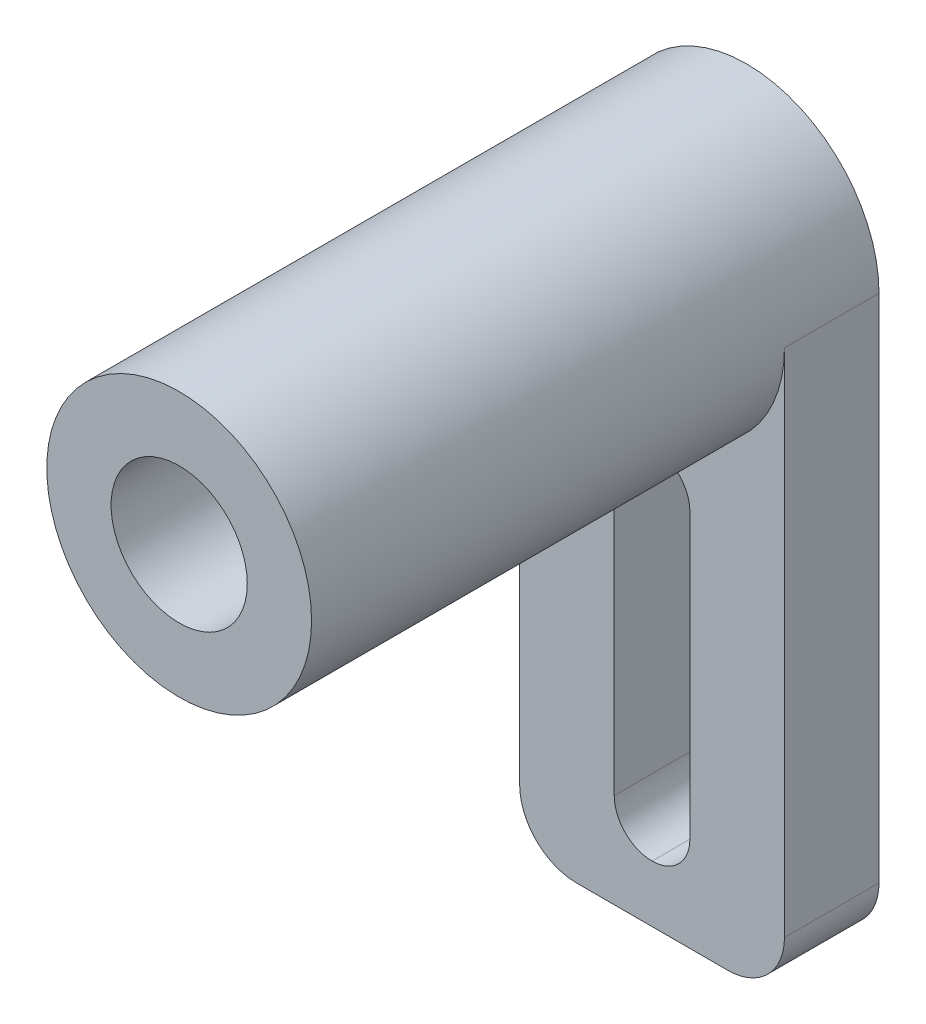
from build123d import *

# Parameters (mm, degrees)
SZKIC1_W                    = 14
SZKIC1_H                    = 25
DODANIE_WYCI_GNI_CIE1_DEPTH = 5
SZKIC2_W                    = 4
SZKIC2_H                    = 19
WYTNIJ_WYCI_GNI_CIE1_DEPTH  = 5
ZAOKR_GLENIE1_R             = 2
ZAOKR_GLENIE2_R             = 3
SZKIC3_R                    = 7
SZKIC3_R_2                  = 3.05
DODANIE_WYCI_GNI_CIE2_DEPTH = 30
DODANIE_WYCI_GNI_CIE3_DEPTH = 5
SZKIC5_R                    = 5
SZKIC5_R_2                  = 2.2
DODANIE_WYCI_GNI_CIE4_DEPTH = 1
SZKIC6_R                    = 3.6
WYTNIJ_WYCI_GNI_CIE2_DEPTH  = 22


with BuildPart() as part:
    # Szkic1 → Dodanie-wyciągnięcie1 (new body)
    with BuildSketch(Plane.XY):
        with Locations((7, 12.5)):
            Rectangle(SZKIC1_W, SZKIC1_H)
    extrude(amount=DODANIE_WYCI_GNI_CIE1_DEPTH)

    # Szkic2 → Wytnij-wyciągnięcie1 (cut)
    with BuildSketch(Plane.XY.offset(5)):
        with Locations((7, 12.5)):
            Rectangle(SZKIC2_W, SZKIC2_H)
    extrude(amount=-WYTNIJ_WYCI_GNI_CIE1_DEPTH, mode=Mode.SUBTRACT)

    # Zaokrąglenie1
    zaokr_glenie1_edges = [part.edges().sort_by_distance(p)[0] for p in [
        (5, 3, 2.5),
        (9, 3, 2.5),
        (9, 22, 2.5),
        (5, 22, 2.5),
    ]]
    fillet(zaokr_glenie1_edges, radius=ZAOKR_GLENIE1_R - 0.0001)  # a hair under: the kernel refuses the full size

    # Zaokrąglenie2
    zaokr_glenie2_edges = [part.edges().sort_by_distance(p)[0] for p in [
        (14, 0, 2.5),
        (0, 0, 2.5),
    ]]
    fillet(zaokr_glenie2_edges, radius=ZAOKR_GLENIE2_R)

    # Szkic3 → Dodanie-wyciągnięcie2 (add)
    with BuildSketch(Plane.XY):
        with Locations(Location((7, 30, 0), (0, 0, 225.584691403))):
            Circle(SZKIC3_R)
        with Locations((7, 30)):
            Circle(SZKIC3_R_2, mode=Mode.SUBTRACT)
    extrude(amount=DODANIE_WYCI_GNI_CIE2_DEPTH)

    # Szkic4 → Dodanie-wyciągnięcie3 (add)
    with BuildSketch(Plane(origin=(0, 0, 0), x_dir=(-1, 0, 0), z_dir=(0, 0, -1))):
        Polygon((-14, 25), (-14, 30), (-11.004847048, 25), align=None)
        Polygon((-2.101020514, 25), (0, 30), (0, 25), align=None)
    extrude(amount=-DODANIE_WYCI_GNI_CIE3_DEPTH)

    # Szkic5 → Dodanie-wyciągnięcie4 (add)
    with BuildSketch(Plane(origin=(0, 0, 0), x_dir=(-1, 0, 0), z_dir=(0, 0, -1))):
        with Locations((-7, 30)):
            Circle(SZKIC5_R)
        with Locations((-7, 30)):
            Circle(SZKIC5_R_2, mode=Mode.SUBTRACT)
    extrude(amount=-DODANIE_WYCI_GNI_CIE4_DEPTH)

    # Szkic6 → Wytnij-wyciągnięcie2 (cut)
    with BuildSketch(Plane.XY.offset(30)):
        with Locations((7, 30)):
            Circle(SZKIC6_R)
    extrude(amount=-WYTNIJ_WYCI_GNI_CIE2_DEPTH, mode=Mode.SUBTRACT)


solid = part.part
